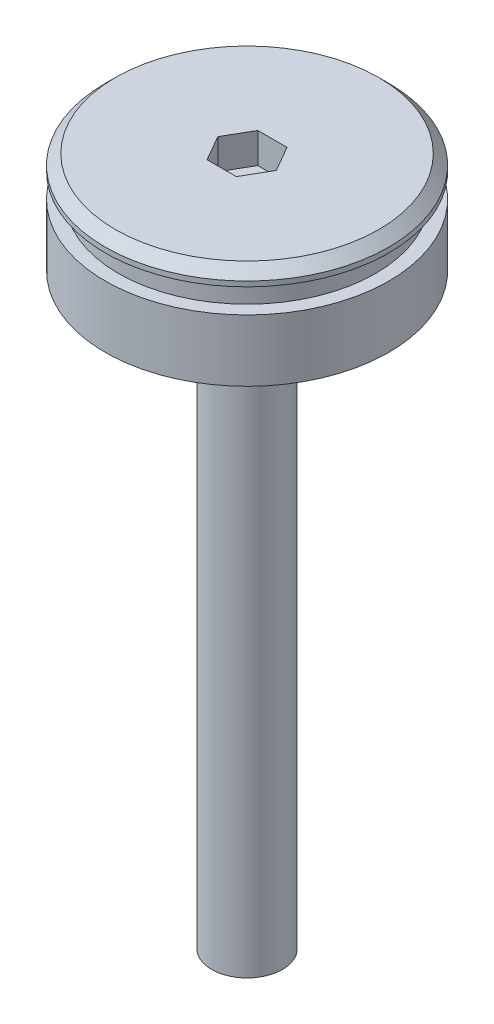
from build123d import *

# Parameters (mm, degrees)
SMUSSO1_SIZE             = 1
TAGLIO_ESTRUSIONE1_DEPTH = 3
SCHIZZO4_R               = 1.5
TAGLIO_ESTRUSIONE3_DEPTH = 8


with BuildPart() as part:
    # Schizzo1 → Rivoluzione1 (revolve)
    with BuildSketch(Plane.XY):
        Polygon((-3.5, 0), (0, 0), (0, 68), (-14, 68), (-14, 66.5), (-12.7, 66.5), (-12.7, 64.1), (-14, 64.1), (-14, 58), (-3.5, 58), align=None)
    revolve(axis=Axis((0, 0, 0), (0, 1, 0)))

    # Smusso1
    smusso1_edges = [part.edges().sort_by_distance(p)[0] for p in [
        (14, 68, 0),
    ]]
    chamfer(smusso1_edges, length=SMUSSO1_SIZE)

    # Schizzo2 → Taglio-Estrusione1 (cut)
    with BuildSketch(Plane(origin=(0, 68, 0), x_dir=(1, 0, 0), z_dir=(0, 1, 0))):
        Polygon((-1.443375673, 2.5), (-2.886751346, 0), (-1.443375673, -2.5), (1.443375673, -2.5), (2.886751346, 0), (1.443375673, 2.5), align=None)
    extrude(amount=-TAGLIO_ESTRUSIONE1_DEPTH, mode=Mode.SUBTRACT)

    # Schizzo4 → Taglio-Estrusione3 (cut)
    with BuildSketch(Plane(origin=(0, 0, -14), x_dir=(-1, 0, 0), z_dir=(0, 0, -1))):
        with Locations((0, 62)):
            Circle(SCHIZZO4_R)
    extrude(amount=-TAGLIO_ESTRUSIONE3_DEPTH, mode=Mode.SUBTRACT)


solid = part.part
